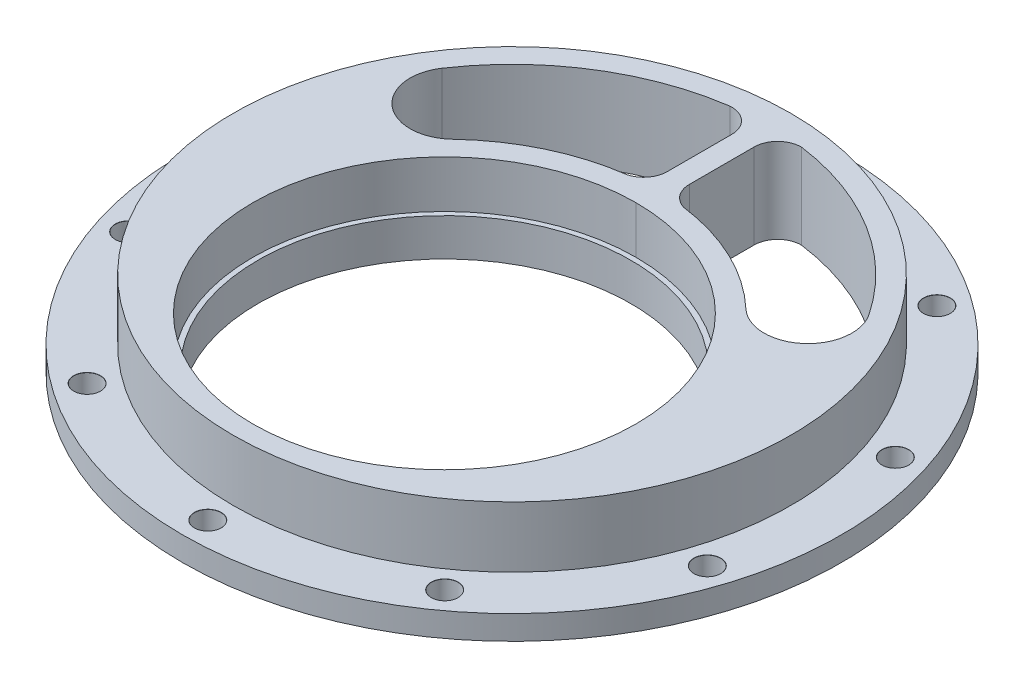
from build123d import *

# Parameters (mm, degrees)
SKETCH1_R                       = 35.052
BOSS_EXTRUDE1_DEPTH             = 4.5212
SKETCH3_R                       = 52.3875
BOSS_EXTRUDE2_DEPTH             = 11.43
SKETCH4_R                       = 35.052
CUT_EXTRUDE1_DEPTH              = 89.998629731
SKETCH9_R                       = 36.000000009
CUT_EXTRUDE3_DEPTH              = 8.89
F_5_0MM_DOWEL_HOLE1_D           = 5
F_5_0MM_DOWEL_HOLE1_CSINK_D     = 5.05
F_5_0MM_DOWEL_HOLE1_CSINK_ANGLE = 90
CIRPATTERN1_COUNT               = 10
CUT_EXTRUDE5_DEPTH              = 89.998629731
BOSS_EXTRUDE3_REACH             = 89.92
BOSS_EXTRUDE3_DIRECTION_2_REACH = 89.92


with BuildPart() as part:
    # Sketch1 → Boss-Extrude1 (new body)
    with BuildSketch(Plane(origin=(0, 0, 0), x_dir=(1, 0, 0), z_dir=(0, 1, 0))):
        with BuildLine():
            ThreePointArc((0, 61.9125), (-43.77874859, -43.77874859), (61.9125, 0))
            ThreePointArc((61.9125, 0), (43.77874859, 43.77874859), (0, 61.9125))
        make_face()
        with Locations((0, -12.7)):
            Circle(SKETCH1_R, mode=Mode.SUBTRACT)
    extrude(amount=BOSS_EXTRUDE1_DEPTH)

    # Sketch3 → Boss-Extrude2 (add)
    with BuildSketch(Plane(origin=(0, 4.5212, 0), x_dir=(1, 0, 0), z_dir=(0, 1, 0))):
        Circle(SKETCH3_R)
    extrude(amount=BOSS_EXTRUDE2_DEPTH)

    # Sketch4 → Cut-Extrude1 (cut, through all)
    with BuildSketch(Plane.XZ):
        with Locations((0, 12.7)):
            Circle(SKETCH4_R)
    extrude(amount=-CUT_EXTRUDE1_DEPTH, mode=Mode.SUBTRACT)

    # Sketch9 → Cut-Extrude3 (cut)
    with BuildSketch(Plane(origin=(0, 15.9512, 0), x_dir=(1, 0, 0), z_dir=(0, 1, 0))):
        with Locations((0, -12.7)):
            Circle(SKETCH9_R)
    extrude(amount=-CUT_EXTRUDE3_DEPTH, mode=Mode.SUBTRACT)

    # Ø5.0mm Dowel Hole1 (through all)
    with Locations(Plane(origin=(0, 4.5212, 0), x_dir=(1, 0, 0), z_dir=(0, 1, 0))):
        with Locations((0, 57.15)):
            f_5_0mm_dowel_hole1 = CounterSinkHole(F_5_0MM_DOWEL_HOLE1_D / 2, F_5_0MM_DOWEL_HOLE1_CSINK_D / 2, counter_sink_angle=F_5_0MM_DOWEL_HOLE1_CSINK_ANGLE)

    # CirPattern1: Ø5.0mm Dowel Hole1 ×10 about axis
    cirpattern1_axis = Axis((0, 15.9512, 0), (0, -1, 0))
    for i in range(1, CIRPATTERN1_COUNT):
        add(f_5_0mm_dowel_hole1.rotate(cirpattern1_axis, i * 360 / CIRPATTERN1_COUNT), mode=Mode.SUBTRACT)

    # Sketch10 → Cut-Extrude5 (cut, through all)
    with BuildSketch(Plane(origin=(0, 15.9512, 0), x_dir=(1, 0, 0), z_dir=(0, 1, 0))):
        with BuildLine():
            ThreePointArc((-27.568698422, 16.370448294), (0, 27.364000009), (27.568698422, 16.370448294))
            ThreePointArc((27.568698422, 16.370448294), (38.57955057, 16.056999754), (40.099152196, 26.966991775))
            ThreePointArc((40.099152196, 26.966991775), (0, 48.3235), (-40.099152196, 26.966991775))
            ThreePointArc((-40.099152196, 26.966991775), (-38.57955057, 16.056999754), (-27.568698422, 16.370448294))
        make_face()
    extrude(amount=-CUT_EXTRUDE5_DEPTH, mode=Mode.SUBTRACT)

    # Boss-Extrude3: up to this face of the body (flat: up to its plane)
    boss_extrude3_end = Plane(part.part.faces().sort_by_distance((-50.90575774, 15.9512, 0))[0])
    # Sketch15 → Boss-Extrude3 (add, up to the picked face)
    with BuildSketch(Plane(origin=(0, 7.9756, 0), x_dir=(1, 0, 0), z_dir=(0, 1, 0)), mode=Mode.PRIVATE) as boss_extrude3_sk1:
        with BuildLine():
            Line((-2.11713302, 43.39578959), (-2.11713302, 31.283478782))
            ThreePointArc((-2.11713302, 31.283478782), (-3.020045747, 28.598028587), (-5.361966653, 27.003569239))
            ThreePointArc((-5.361966653, 27.003569239), (-0.056014781, 27.363960851), (5.250924096, 27.018407481))
            ThreePointArc((5.250924096, 27.018407481), (2.926793499, 28.616259533), (2.032, 31.29096677))
            Line((2.032, 31.29096677), (2.032, 43.438919063))
            ThreePointArc((2.032, 43.438919063), (3.343379097, 46.591449005), (6.503741299, 47.883838624))
            ThreePointArc((6.503741299, 47.883838624), (-0.203176512, 48.32307287), (-6.906163701, 47.827456081))
            ThreePointArc((-6.906163701, 47.827456081), (-3.543125847, 46.658245825), (-2.11713302, 43.39578959))
        make_face()
    boss_extrude3_tool1 = split(extrude(boss_extrude3_sk1.sketch, amount=BOSS_EXTRUDE3_REACH, mode=Mode.PRIVATE), bisect_by=boss_extrude3_end, keep=Keep.BOTH, mode=Mode.PRIVATE)
    add(boss_extrude3_tool1.solids().sort_by(Axis((-0.049426, 7.9756, -38.213586), (0, 1, 0)))[0])

    # Boss-Extrude3 direction 2: up to this face of the body (flat: up to its plane)
    boss_extrude3_direction_2_end = Plane(part.part.faces().sort_by_distance((-60.161350056, 0, 0))[0])
    # Sketch15 → Boss-Extrude3 direction 2 (add, up to the picked face)
    with BuildSketch(Plane(origin=(0, 7.9756, 0), x_dir=(1, 0, 0), z_dir=(0, 1, 0)), mode=Mode.PRIVATE) as boss_extrude3_direction_2_sk1:
        with BuildLine():
            Line((-2.11713302, 43.39578959), (-2.11713302, 31.283478782))
            ThreePointArc((-2.11713302, 31.283478782), (-3.020045747, 28.598028587), (-5.361966653, 27.003569239))
            ThreePointArc((-5.361966653, 27.003569239), (-0.056014781, 27.363960851), (5.250924096, 27.018407481))
            ThreePointArc((5.250924096, 27.018407481), (2.926793499, 28.616259533), (2.032, 31.29096677))
            Line((2.032, 31.29096677), (2.032, 43.438919063))
            ThreePointArc((2.032, 43.438919063), (3.343379097, 46.591449005), (6.503741299, 47.883838624))
            ThreePointArc((6.503741299, 47.883838624), (-0.203176512, 48.32307287), (-6.906163701, 47.827456081))
            ThreePointArc((-6.906163701, 47.827456081), (-3.543125847, 46.658245825), (-2.11713302, 43.39578959))
        make_face()
    boss_extrude3_direction_2_tool1 = split(extrude(boss_extrude3_direction_2_sk1.sketch, amount=-BOSS_EXTRUDE3_DIRECTION_2_REACH, mode=Mode.PRIVATE), bisect_by=boss_extrude3_direction_2_end, keep=Keep.BOTH, mode=Mode.PRIVATE)
    add(boss_extrude3_direction_2_tool1.solids().sort_by(Axis((-0.049426, 7.9756, -38.213586), (0, -1, 0)))[0])


solid = part.part
